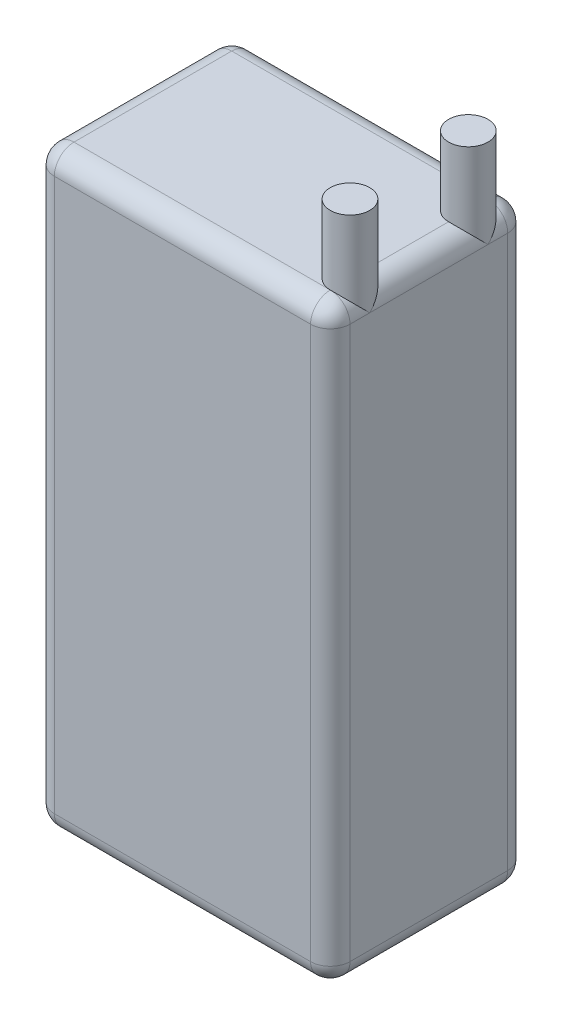
from build123d import *

# Parameters (mm, degrees)
SKETCH1_W           = 30
SKETCH1_H           = 20
BOSS_EXTRUDE1_DEPTH = 60
SKETCH2_R           = 2
BOSS_EXTRUDE2_DEPTH = 7
FILLET1_R           = 2


with BuildPart() as part:
    # Sketch1 → Boss-Extrude1 (new body)
    with BuildSketch(Plane(origin=(0, 0, 0), x_dir=(1, 0, 0), z_dir=(0, 1, 0))):
        Rectangle(SKETCH1_W, SKETCH1_H)
    extrude(amount=BOSS_EXTRUDE1_DEPTH)

    # Sketch2 → Boss-Extrude2 (add)
    with BuildSketch(Plane(origin=(0, 60, 0), x_dir=(1, 0, 0), z_dir=(0, 1, 0))):
        with Locations((13, 6)):
            Circle(SKETCH2_R)
        with Locations((13, -6)):
            Circle(SKETCH2_R)
    extrude(amount=BOSS_EXTRUDE2_DEPTH)

    # Fillet1
    # the kernel refuses this fillet: 2 mm, written as the material it takes off along each edge
    with BuildSketch(Plane(origin=(13, 58, 8), x_dir=(0, 1, 0), z_dir=(1, 0, 0))) as fillet1_piece_1_section:
        Polygon((0, 0), (FILLET1_R * 1.02, 0), (FILLET1_R * 1.02, FILLET1_R * 1.02), (0, FILLET1_R * 1.02), align=None)
    fillet1_piece_1 = extrude(amount=FILLET1_R * 1.02, mode=Mode.PRIVATE)
    fillet1_piece_1 = fillet1_piece_1 - Plane(origin=(13, 58, 8), x_dir=(0, -0.7071067811865475, -0.7071067811865475), z_dir=(1, 0, 0)) * Sphere(FILLET1_R, mode=Mode.PRIVATE)
    add(fillet1_piece_1, mode=Mode.SUBTRACT)
    with BuildSketch(Plane(origin=(13, 58, -8), x_dir=(1, 0, 0), z_dir=(0, 0, -1))) as fillet1_piece_2_section:
        Polygon((0, 0), (FILLET1_R * 1.02, 0), (FILLET1_R * 1.02, -FILLET1_R * 1.02), (0, -FILLET1_R * 1.02), align=None)
    fillet1_piece_2 = extrude(amount=FILLET1_R * 1.02, mode=Mode.PRIVATE)
    fillet1_piece_2 = fillet1_piece_2 - Plane(origin=(13, 58, -8), x_dir=(-0.7071067811865475, -0.7071067811865475, 0), z_dir=(0, 0, -1)) * Sphere(FILLET1_R, mode=Mode.PRIVATE)
    add(fillet1_piece_2, mode=Mode.SUBTRACT)
    with BuildSketch(Plane(origin=(-13, 58, -8), x_dir=(-1, 0, 0), z_dir=(0, 0, -1))) as fillet1_piece_3_section:
        Polygon((0, 0), (FILLET1_R * 1.02, 0), (FILLET1_R * 1.02, FILLET1_R * 1.02), (0, FILLET1_R * 1.02), align=None)
    fillet1_piece_3 = extrude(amount=FILLET1_R * 1.02, mode=Mode.PRIVATE)
    fillet1_piece_3 = fillet1_piece_3 - Plane(origin=(-13, 58, -8), x_dir=(0.7071067811865475, -0.7071067811865475, 0), z_dir=(0, 0, -1)) * Sphere(FILLET1_R, mode=Mode.PRIVATE)
    add(fillet1_piece_3, mode=Mode.SUBTRACT)
    with BuildSketch(Plane(origin=(-13, 58, 8), x_dir=(0, 1, 0), z_dir=(-1, 0, 0))) as fillet1_piece_4_section:
        Polygon((0, 0), (FILLET1_R * 1.02, 0), (FILLET1_R * 1.02, -FILLET1_R * 1.02), (0, -FILLET1_R * 1.02), align=None)
    fillet1_piece_4 = extrude(amount=FILLET1_R * 1.02, mode=Mode.PRIVATE)
    fillet1_piece_4 = fillet1_piece_4 - Plane(origin=(-13, 58, 8), x_dir=(0, -0.7071067811865475, -0.7071067811865475), z_dir=(-1, 0, 0)) * Sphere(FILLET1_R, mode=Mode.PRIVATE)
    add(fillet1_piece_4, mode=Mode.SUBTRACT)
    with BuildSketch(Plane(origin=(13, 2, -8), x_dir=(1, 0, 0), z_dir=(0, 0, -1))) as fillet1_piece_5_section:
        Polygon((0, 0), (FILLET1_R * 1.02, 0), (FILLET1_R * 1.02, FILLET1_R * 1.02), (0, FILLET1_R * 1.02), align=None)
    fillet1_piece_5 = extrude(amount=FILLET1_R * 1.02, mode=Mode.PRIVATE)
    fillet1_piece_5 = fillet1_piece_5 - Plane(origin=(13, 2, -8), x_dir=(-0.7071067811865475, 0.7071067811865475, 0), z_dir=(0, 0, -1)) * Sphere(FILLET1_R, mode=Mode.PRIVATE)
    add(fillet1_piece_5, mode=Mode.SUBTRACT)
    with BuildSketch(Plane(origin=(-13, 2, -8), x_dir=(-1, 0, 0), z_dir=(0, 0, -1))) as fillet1_piece_6_section:
        Polygon((0, 0), (FILLET1_R * 1.02, 0), (FILLET1_R * 1.02, -FILLET1_R * 1.02), (0, -FILLET1_R * 1.02), align=None)
    fillet1_piece_6 = extrude(amount=FILLET1_R * 1.02, mode=Mode.PRIVATE)
    fillet1_piece_6 = fillet1_piece_6 - Plane(origin=(-13, 2, -8), x_dir=(0.7071067811865475, 0.7071067811865475, 0), z_dir=(0, 0, -1)) * Sphere(FILLET1_R, mode=Mode.PRIVATE)
    add(fillet1_piece_6, mode=Mode.SUBTRACT)
    with BuildSketch(Plane(origin=(13, 2, 8), x_dir=(0, -1, 0), z_dir=(1, 0, 0))) as fillet1_piece_7_section:
        Polygon((0, 0), (FILLET1_R * 1.02, 0), (FILLET1_R * 1.02, -FILLET1_R * 1.02), (0, -FILLET1_R * 1.02), align=None)
    fillet1_piece_7 = extrude(amount=FILLET1_R * 1.02, mode=Mode.PRIVATE)
    fillet1_piece_7 = fillet1_piece_7 - Plane(origin=(13, 2, 8), x_dir=(0, 0.7071067811865475, -0.7071067811865475), z_dir=(1, 0, 0)) * Sphere(FILLET1_R, mode=Mode.PRIVATE)
    add(fillet1_piece_7, mode=Mode.SUBTRACT)
    with BuildSketch(Plane(origin=(-13, 2, 8), x_dir=(0, -1, 0), z_dir=(-1, 0, 0))) as fillet1_piece_8_section:
        Polygon((0, 0), (FILLET1_R * 1.02, 0), (FILLET1_R * 1.02, FILLET1_R * 1.02), (0, FILLET1_R * 1.02), align=None)
    fillet1_piece_8 = extrude(amount=FILLET1_R * 1.02, mode=Mode.PRIVATE)
    fillet1_piece_8 = fillet1_piece_8 - Plane(origin=(-13, 2, 8), x_dir=(0, 0.7071067811865475, -0.7071067811865475), z_dir=(-1, 0, 0)) * Sphere(FILLET1_R, mode=Mode.PRIVATE)
    add(fillet1_piece_8, mode=Mode.SUBTRACT)
    with BuildSketch(Plane(origin=(15, 60, 8), x_dir=(0, -1, 0), z_dir=(0, 0, -1))) as fillet1_piece_9_section:
        with BuildLine():
            CenterArc((FILLET1_R, FILLET1_R), FILLET1_R, 180, 90)
            Line((0, FILLET1_R), (0, 0))
            Line((0, 0), (FILLET1_R, 0))
        make_face()
    fillet1_piece_9 = extrude(amount=2, mode=Mode.PRIVATE)
    fillet1_piece_9 = fillet1_piece_9 - Plane(origin=(13, 59.42884434, 6), x_dir=(1, 0, 0), z_dir=(0, -1, 0)) * Cylinder(2, 12, mode=Mode.PRIVATE)
    add(fillet1_piece_9, mode=Mode.SUBTRACT)
    with BuildSketch(Plane(origin=(15, 60, -6), x_dir=(0, -1, 0), z_dir=(0, 0, -1))) as fillet1_piece_10_section:
        with BuildLine():
            CenterArc((FILLET1_R, FILLET1_R), FILLET1_R, 180, 90)
            Line((0, FILLET1_R), (0, 0))
            Line((0, 0), (FILLET1_R, 0))
        make_face()
    fillet1_piece_10 = extrude(amount=2, mode=Mode.PRIVATE)
    fillet1_piece_10 = fillet1_piece_10 - Plane(origin=(13, 59.42884434, -6), x_dir=(1, 0, 0), z_dir=(0, -1, 0)) * Cylinder(2, 13, mode=Mode.PRIVATE)
    add(fillet1_piece_10, mode=Mode.SUBTRACT)
    with BuildSketch(Plane(origin=(13, 60, -10), x_dir=(0, -1, 0), z_dir=(-1, 0, 0)), Plane(origin=(-13, 0, 10), x_dir=(0, 0, -1), z_dir=(1, 0, 0))) as fillet1_piece_11:
        with BuildLine():
            CenterArc((FILLET1_R, FILLET1_R), FILLET1_R, 180, 90)
            Line((0, FILLET1_R), (0, 0))
            Line((0, 0), (FILLET1_R, 0))
        make_face()
    extrude(amount=26, mode=Mode.SUBTRACT)
    with BuildSketch(Plane(origin=(15, 60, 6), x_dir=(0, -1, 0), z_dir=(0, 0, -1))) as fillet1_piece_12_section:
        with BuildLine():
            CenterArc((FILLET1_R, FILLET1_R), FILLET1_R, 180, 90)
            Line((0, FILLET1_R), (0, 0))
            Line((0, 0), (FILLET1_R, 0))
        make_face()
    fillet1_piece_12 = extrude(amount=12, mode=Mode.PRIVATE)
    fillet1_piece_12 = fillet1_piece_12 - Plane(origin=(13, 59.530547013, 6), x_dir=(1, 0, 0), z_dir=(0, -1, 0)) * Cylinder(2, 32, mode=Mode.PRIVATE)
    fillet1_piece_12 = fillet1_piece_12 - Plane(origin=(13, 59.530547013, -6), x_dir=(1, 0, 0), z_dir=(0, -1, 0)) * Cylinder(2, 32, mode=Mode.PRIVATE)
    add(fillet1_piece_12, mode=Mode.SUBTRACT)
    with BuildSketch(Plane(origin=(-15, 60, -8), x_dir=(0, -1, 0), z_dir=(0, 0, 1))) as fillet1_piece_13:
        with BuildLine():
            CenterArc((FILLET1_R, FILLET1_R), FILLET1_R, 180, 90)
            Line((0, FILLET1_R), (0, 0))
            Line((0, 0), (FILLET1_R, 0))
        make_face()
    extrude(amount=16, mode=Mode.SUBTRACT)
    with BuildSketch(Plane(origin=(13, 0, -10), x_dir=(0, 1, 0), z_dir=(-1, 0, 0)), Plane(origin=(-13, 60, 10), x_dir=(0, 0, -1), z_dir=(1, 0, 0))) as fillet1_piece_14:
        with BuildLine():
            CenterArc((FILLET1_R, -FILLET1_R), FILLET1_R, 90, 90)
            Line((0, -FILLET1_R), (0, 0))
            Line((0, 0), (FILLET1_R, 0))
        make_face()
    extrude(amount=26, mode=Mode.SUBTRACT)
    with BuildSketch(Plane(origin=(15, 0, 8), x_dir=(0, 1, 0), z_dir=(0, 0, -1)), Plane(origin=(-15, 0, -8), x_dir=(0, 1, 0), z_dir=(0, 0, 1))) as fillet1_piece_15:
        with BuildLine():
            CenterArc((FILLET1_R, -FILLET1_R), FILLET1_R, 90, 90)
            Line((0, -FILLET1_R), (0, 0))
            Line((0, 0), (FILLET1_R, 0))
        make_face()
    extrude(amount=16, mode=Mode.SUBTRACT)
    with BuildSketch(Plane(origin=(-15, 2, -10), x_dir=(1, 0, 0), z_dir=(0, 1, 0)), Plane(origin=(-15, 2, 10), x_dir=(0, 0, -1), z_dir=(0, 1, 0))) as fillet1_piece_16:
        with BuildLine():
            CenterArc((FILLET1_R, -FILLET1_R), FILLET1_R, 90, 90)
            Line((0, -FILLET1_R), (0, 0))
            Line((0, 0), (FILLET1_R, 0))
        make_face()
    extrude(amount=56, mode=Mode.SUBTRACT)
    with BuildSketch(Plane(origin=(15, 2, -10), x_dir=(-1, 0, 0), z_dir=(0, 1, 0)), Plane(origin=(15, 2, 10), x_dir=(0, 0, -1), z_dir=(0, 1, 0))) as fillet1_piece_17:
        with BuildLine():
            CenterArc((FILLET1_R, FILLET1_R), FILLET1_R, 180, 90)
            Line((0, FILLET1_R), (0, 0))
            Line((0, 0), (FILLET1_R, 0))
        make_face()
    extrude(amount=56, mode=Mode.SUBTRACT)


solid = part.part
